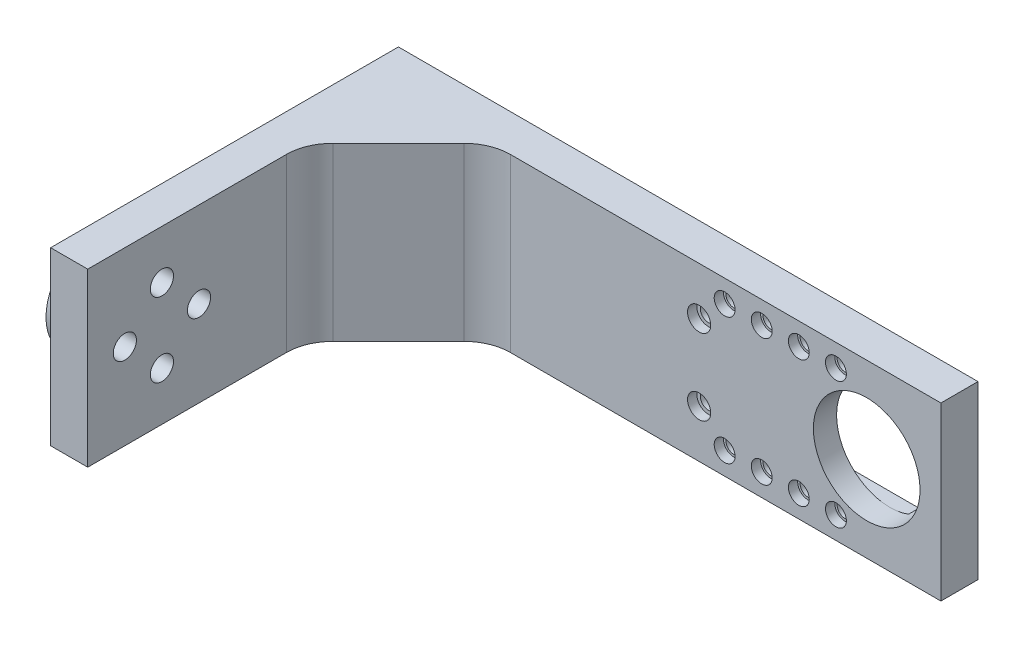
from build123d import *

# Parameters (mm, degrees)
BOSS_EXTRUDE1_DEPTH = 37
CUT_EXTRUDE1_REACH  = 152.396
CUT_EXTRUDE2_REACH  = 152.396
SKETCH3_R           = 1.75
CUT_EXTRUDE5_REACH  = 152.396
SKETCH5_R           = 1.75
BOSS_EXTRUDE3_START = 6
SKETCH6_R           = 11
SKETCH6_R_2         = 1.75
BOSS_EXTRUDE3_DEPTH = 6
SKETCH4_W           = 38
SKETCH4_H           = 23
CUT_EXTRUDE6_DEPTH  = 3
SKETCH9_R           = 2.25
CUT_EXTRUDE8_DEPTH  = 2
SKETCH10_R          = 2.5
CUT_EXTRUDE9_DEPTH  = 6
CHAMFER1_SIZE       = 20
FILLET5_R           = 10
CUT_EXTRUDE10_REACH = 148.571
SKETCH11_R          = 1.75
SKETCH12_R          = 2.5
CUT_EXTRUDE11_DEPTH = 2
SKETCH7_W           = 3
SKETCH7_H           = 23
BOSS_EXTRUDE4_DEPTH = 0.5


with BuildPart() as part:
    # Sketch1 → Boss-Extrude1 (new body)
    with BuildSketch(Plane(origin=(0, 0, 0), x_dir=(1, 0, 0), z_dir=(0, 1, 0))):
        Polygon((0, 0), (0, 75), (125, 75), (125, 67), (8, 67), (8, 0), align=None)
    extrude(amount=BOSS_EXTRUDE1_DEPTH)

    # Sketch2 → Cut-Extrude1 (cut, up to next)
    with BuildSketch(Plane(origin=(0, 0, -75), x_dir=(-1, 0, 0), z_dir=(0, 0, -1)), mode=Mode.PRIVATE) as cut_extrude1_sk1:
        with BuildLine():
            ThreePointArc((-120.5, 18.5), (-109, 7), (-97.5, 18.5))
            ThreePointArc((-97.5, 18.5), (-109, 30), (-120.5, 18.5))
        make_face()
    cut_extrude1_tool1 = extrude(cut_extrude1_sk1.sketch, amount=-CUT_EXTRUDE1_REACH, mode=Mode.PRIVATE) & part.part
    add(cut_extrude1_tool1.solids().sort_by_distance((109, 18.5, -75))[0], mode=Mode.SUBTRACT)

    # Sketch3 → Cut-Extrude2 (cut, up to next)
    with BuildSketch(Plane(origin=(0, 0, -75), x_dir=(-1, 0, 0), z_dir=(0, 0, -1)), mode=Mode.PRIVATE) as cut_extrude2_sk1:
        with Locations((-102.36, 32.19)):
            Circle(SKETCH3_R)
    cut_extrude2_tool1 = extrude(cut_extrude2_sk1.sketch, amount=-CUT_EXTRUDE2_REACH, mode=Mode.PRIVATE) & part.part
    # Sketch3 → Cut-Extrude2 (cut, up to next)
    with BuildSketch(Plane(origin=(0, 0, -75), x_dir=(-1, 0, 0), z_dir=(0, 0, -1)), mode=Mode.PRIVATE) as cut_extrude2_sk2:
        with Locations((-94.36, 32.19)):
            Circle(SKETCH3_R)
    cut_extrude2_tool2 = extrude(cut_extrude2_sk2.sketch, amount=-CUT_EXTRUDE2_REACH, mode=Mode.PRIVATE) & part.part
    # Sketch3 → Cut-Extrude2 (cut, up to next)
    with BuildSketch(Plane(origin=(0, 0, -75), x_dir=(-1, 0, 0), z_dir=(0, 0, -1)), mode=Mode.PRIVATE) as cut_extrude2_sk3:
        with Locations((-86.36, 32.19)):
            Circle(SKETCH3_R)
    cut_extrude2_tool3 = extrude(cut_extrude2_sk3.sketch, amount=-CUT_EXTRUDE2_REACH, mode=Mode.PRIVATE) & part.part
    # Sketch3 → Cut-Extrude2 (cut, up to next)
    with BuildSketch(Plane(origin=(0, 0, -75), x_dir=(-1, 0, 0), z_dir=(0, 0, -1)), mode=Mode.PRIVATE) as cut_extrude2_sk4:
        with Locations((-78.36, 32.19)):
            Circle(SKETCH3_R)
    cut_extrude2_tool4 = extrude(cut_extrude2_sk4.sketch, amount=-CUT_EXTRUDE2_REACH, mode=Mode.PRIVATE) & part.part
    # Sketch3 → Cut-Extrude2 (cut, up to next)
    with BuildSketch(Plane(origin=(0, 0, -75), x_dir=(-1, 0, 0), z_dir=(0, 0, -1)), mode=Mode.PRIVATE) as cut_extrude2_sk5:
        with Locations((-78.36, 4.81)):
            Circle(SKETCH3_R)
    cut_extrude2_tool5 = extrude(cut_extrude2_sk5.sketch, amount=-CUT_EXTRUDE2_REACH, mode=Mode.PRIVATE) & part.part
    # Sketch3 → Cut-Extrude2 (cut, up to next)
    with BuildSketch(Plane(origin=(0, 0, -75), x_dir=(-1, 0, 0), z_dir=(0, 0, -1)), mode=Mode.PRIVATE) as cut_extrude2_sk6:
        with Locations((-86.36, 4.81)):
            Circle(SKETCH3_R)
    cut_extrude2_tool6 = extrude(cut_extrude2_sk6.sketch, amount=-CUT_EXTRUDE2_REACH, mode=Mode.PRIVATE) & part.part
    # Sketch3 → Cut-Extrude2 (cut, up to next)
    with BuildSketch(Plane(origin=(0, 0, -75), x_dir=(-1, 0, 0), z_dir=(0, 0, -1)), mode=Mode.PRIVATE) as cut_extrude2_sk7:
        with Locations((-94.36, 4.81)):
            Circle(SKETCH3_R)
    cut_extrude2_tool7 = extrude(cut_extrude2_sk7.sketch, amount=-CUT_EXTRUDE2_REACH, mode=Mode.PRIVATE) & part.part
    # Sketch3 → Cut-Extrude2 (cut, up to next)
    with BuildSketch(Plane(origin=(0, 0, -75), x_dir=(-1, 0, 0), z_dir=(0, 0, -1)), mode=Mode.PRIVATE) as cut_extrude2_sk8:
        with Locations((-102.36, 4.81)):
            Circle(SKETCH3_R)
    cut_extrude2_tool8 = extrude(cut_extrude2_sk8.sketch, amount=-CUT_EXTRUDE2_REACH, mode=Mode.PRIVATE) & part.part
    add(cut_extrude2_tool1.solids().sort_by_distance((102.36, 32.19, -75))[0], mode=Mode.SUBTRACT)
    add(cut_extrude2_tool2.solids().sort_by_distance((94.36, 32.19, -75))[0], mode=Mode.SUBTRACT)
    add(cut_extrude2_tool3.solids().sort_by_distance((86.36, 32.19, -75))[0], mode=Mode.SUBTRACT)
    add(cut_extrude2_tool4.solids().sort_by_distance((78.36, 32.19, -75))[0], mode=Mode.SUBTRACT)
    add(cut_extrude2_tool5.solids().sort_by_distance((78.36, 4.81, -75))[0], mode=Mode.SUBTRACT)
    add(cut_extrude2_tool6.solids().sort_by_distance((86.36, 4.81, -75))[0], mode=Mode.SUBTRACT)
    add(cut_extrude2_tool7.solids().sort_by_distance((94.36, 4.81, -75))[0], mode=Mode.SUBTRACT)
    add(cut_extrude2_tool8.solids().sort_by_distance((102.36, 4.81, -75))[0], mode=Mode.SUBTRACT)

    # Sketch5 → Cut-Extrude5 (cut, up to next)
    with BuildSketch(Plane.ZY, mode=Mode.PRIVATE) as cut_extrude5_sk1:
        with Locations((-16, 10.5)):
            Circle(SKETCH5_R)
    cut_extrude5_tool1 = extrude(cut_extrude5_sk1.sketch, amount=-CUT_EXTRUDE5_REACH, mode=Mode.PRIVATE) & part.part
    # Sketch5 → Cut-Extrude5 (cut, up to next)
    with BuildSketch(Plane.ZY, mode=Mode.PRIVATE) as cut_extrude5_sk2:
        with Locations((-24, 18.5)):
            Circle(SKETCH5_R)
    cut_extrude5_tool2 = extrude(cut_extrude5_sk2.sketch, amount=-CUT_EXTRUDE5_REACH, mode=Mode.PRIVATE) & part.part
    # Sketch5 → Cut-Extrude5 (cut, up to next)
    with BuildSketch(Plane.ZY, mode=Mode.PRIVATE) as cut_extrude5_sk3:
        with Locations((-16, 26.5)):
            Circle(SKETCH5_R)
    cut_extrude5_tool3 = extrude(cut_extrude5_sk3.sketch, amount=-CUT_EXTRUDE5_REACH, mode=Mode.PRIVATE) & part.part
    # Sketch5 → Cut-Extrude5 (cut, up to next)
    with BuildSketch(Plane.ZY, mode=Mode.PRIVATE) as cut_extrude5_sk4:
        with Locations((-8, 18.5)):
            Circle(SKETCH5_R)
    cut_extrude5_tool4 = extrude(cut_extrude5_sk4.sketch, amount=-CUT_EXTRUDE5_REACH, mode=Mode.PRIVATE) & part.part
    add(cut_extrude5_tool1.solids().sort_by_distance((0, 10.5, -16))[0], mode=Mode.SUBTRACT)
    add(cut_extrude5_tool2.solids().sort_by_distance((0, 18.5, -24))[0], mode=Mode.SUBTRACT)
    add(cut_extrude5_tool3.solids().sort_by_distance((0, 26.5, -16))[0], mode=Mode.SUBTRACT)
    add(cut_extrude5_tool4.solids().sort_by_distance((0, 18.5, -8))[0], mode=Mode.SUBTRACT)

    # Sketch6 → Boss-Extrude3 (add)
    with BuildSketch(Plane.ZY.offset(BOSS_EXTRUDE3_START)):
        with Locations((-16, 18.5)):
            Circle(SKETCH6_R)
        with Locations((-16, 10.5)):
            Circle(SKETCH6_R_2, mode=Mode.SUBTRACT)
        with BuildLine():
            ThreePointArc((-9.75, 18.5), (-8, 20.25), (-6.25, 18.5))
            ThreePointArc((-6.25, 18.5), (-8, 16.75), (-9.75, 18.5))
        make_face(mode=Mode.SUBTRACT)
        with Locations((-24, 18.5)):
            Circle(SKETCH6_R_2, mode=Mode.SUBTRACT)
        with Locations((-16, 26.5)):
            Circle(SKETCH6_R_2, mode=Mode.SUBTRACT)
    extrude(amount=-BOSS_EXTRUDE3_DEPTH)

    # Sketch4 → Cut-Extrude6 (cut)
    with BuildSketch(Plane(origin=(0, 0, -75), x_dir=(-1, 0, 0), z_dir=(0, 0, -1))):
        with Locations((-94, 18.5)):
            Rectangle(SKETCH4_W, SKETCH4_H)
    extrude(amount=-CUT_EXTRUDE6_DEPTH, mode=Mode.SUBTRACT)

    # Sketch9 → Cut-Extrude8 (cut)
    with BuildSketch(Plane.XY.offset(-67)):
        with Locations((78.36, 32.19)):
            Circle(SKETCH9_R)
        with Locations((86.36, 32.19)):
            Circle(SKETCH9_R)
        with Locations((94.36, 32.19)):
            Circle(SKETCH9_R)
        with Locations((102.36, 32.19)):
            Circle(SKETCH9_R)
        with Locations((78.36, 4.81)):
            Circle(SKETCH9_R)
        with Locations((86.36, 4.81)):
            Circle(SKETCH9_R)
        with Locations((94.36, 4.81)):
            Circle(SKETCH9_R)
        with Locations((102.36, 4.81)):
            Circle(SKETCH9_R)
    extrude(amount=-CUT_EXTRUDE8_DEPTH, mode=Mode.SUBTRACT)

    # Sketch10 → Cut-Extrude9 (cut)
    with BuildSketch(Plane(origin=(8, 0, 0), x_dir=(0, 0, -1), z_dir=(1, 0, 0))):
        with Locations((24, 18.5)):
            Circle(SKETCH10_R)
        with Locations((16, 10.5)):
            Circle(SKETCH10_R)
        with Locations((8, 18.5)):
            Circle(SKETCH10_R)
        with Locations((16, 26.5)):
            Circle(SKETCH10_R)
    extrude(amount=-CUT_EXTRUDE9_DEPTH, mode=Mode.SUBTRACT)

    # Chamfer1
    chamfer1_edges = [part.edges().sort_by_distance(p)[0] for p in [
        (8, 18.5, -67),
    ]]
    chamfer(chamfer1_edges, length=CHAMFER1_SIZE)

    # Fillet5
    fillet5_edges = [part.edges().sort_by_distance(p)[0] for p in [
        (8, 18.5, -47),
        (28, 18.5, -67),
    ]]
    fillet(fillet5_edges, radius=FILLET5_R)

    # Sketch11 → Cut-Extrude10 (cut, up to next)
    with BuildSketch(Plane.XY.offset(-67), mode=Mode.PRIVATE) as cut_extrude10_sk1:
        with Locations((72.86, 10.31)):
            Circle(SKETCH11_R)
    cut_extrude10_tool1 = extrude(cut_extrude10_sk1.sketch, amount=-CUT_EXTRUDE10_REACH, mode=Mode.PRIVATE) & part.part
    # Sketch11 → Cut-Extrude10 (cut, up to next)
    with BuildSketch(Plane.XY.offset(-67), mode=Mode.PRIVATE) as cut_extrude10_sk2:
        with Locations((72.86, 26.69)):
            Circle(SKETCH11_R)
    cut_extrude10_tool2 = extrude(cut_extrude10_sk2.sketch, amount=-CUT_EXTRUDE10_REACH, mode=Mode.PRIVATE) & part.part
    add(cut_extrude10_tool1.solids().sort_by_distance((72.86, 10.31, -67))[0], mode=Mode.SUBTRACT)
    add(cut_extrude10_tool2.solids().sort_by_distance((72.86, 26.69, -67))[0], mode=Mode.SUBTRACT)

    # Sketch12 → Cut-Extrude11 (cut)
    with BuildSketch(Plane.XY.offset(-67)):
        with Locations((72.86, 10.31)):
            Circle(SKETCH12_R)
        with Locations((72.86, 26.69)):
            Circle(SKETCH12_R)
    extrude(amount=-CUT_EXTRUDE11_DEPTH, mode=Mode.SUBTRACT)

    # Sketch7 → Boss-Extrude4 (add)
    with BuildSketch(Plane(origin=(75, 0, 0), x_dir=(0, 0, -1), z_dir=(1, 0, 0))):
        with Locations((73.5, 18.5)):
            Rectangle(SKETCH7_W, SKETCH7_H)
    extrude(amount=BOSS_EXTRUDE4_DEPTH)


solid = part.part
